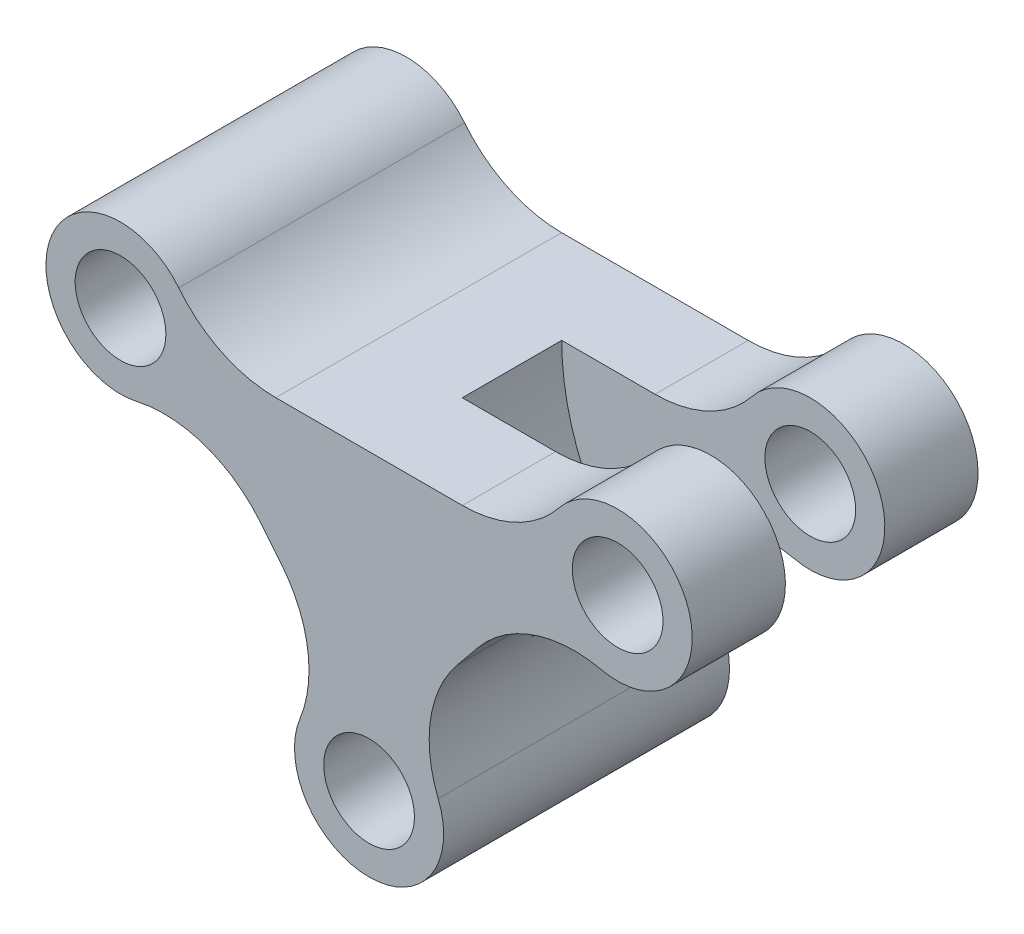
from build123d import *

# Parameters (mm, degrees)
ESQUISSE2_R             = 3
ESQUISSE2_R_2           = 1.825
BOSS_EXTRU_1_DEPTH      = 11.5
ESQUISSE3_R             = 10
ENL_V_MAT_EXTRU_1_DEPTH = 4
CONG_1_R                = 5
FILLET1_R               = 5


with BuildPart() as part:
    # Esquisse2 → Boss.-Extru.1 (new body)
    # profile 1 of 4: a face of its own
    with BuildSketch(Plane.XY):
        with Locations((-10, 5)):
            Circle(ESQUISSE2_R)
        with Locations((-10, 5)):
            Circle(ESQUISSE2_R_2, mode=Mode.SUBTRACT)
    # profile 2 of 4: a face of its own
    with BuildSketch(Plane.XY):
        with Locations((10, 5)):
            Circle(ESQUISSE2_R)
        with Locations((10, 5)):
            Circle(ESQUISSE2_R_2, mode=Mode.SUBTRACT)
    # profile 3 of 4: a face of its own
    with BuildSketch(Plane.XY):
        with Locations((0, -6.825)):
            Circle(ESQUISSE2_R)
        with Locations((0, -6.825)):
            Circle(ESQUISSE2_R_2, mode=Mode.SUBTRACT)
    # profile 4 of 4: a face of its own
    with BuildSketch(Plane.XY):
        Polygon((-8.175, 5), (8.175, 5), (0, -5), align=None)
    extrude(amount=BOSS_EXTRU_1_DEPTH)

    # Esquisse3 → Enlèv. mat.-Extru.1 (cut)
    with BuildSketch(Plane.XY.offset(3.75)):
        with Locations((10, 5)):
            Circle(ESQUISSE3_R)
    extrude(amount=ENL_V_MAT_EXTRU_1_DEPTH, mode=Mode.SUBTRACT)

    # Congé1
    # the kernel refuses this fillet: 5 mm, written as the material it adds along each edge
    with BuildSketch(Plane(origin=(-7, 5, 0), x_dir=(-0.3311912213512006, 0.9435636570469954, 0), z_dir=(0, 0, 1))) as cong_1_piece_1:
        with BuildLine():
            CenterArc((3.643103435, -4.717818285), CONG_1_R, 109.341093727, 51.317812547)
            Line((-1.07471485, -3.061862178), (0, 0))
            ThreePointArc((0, 0), (0.993573664, -0.169309029), (1.987147328, 0))
        make_face()
    extrude(amount=11.5)
    with BuildSketch(Plane(origin=(-7.231093941, 3.845374851, 11.5), x_dir=(-0.7661000074497634, -0.6427213848826507, 0), z_dir=(0, 0, -1))) as cong_1_piece_2:
        with BuildLine():
            CenterArc((5.056907819, -4.440322454), CONG_1_R, 117.368969646, 63.360078756)
            Line((0.057312583, -4.503942212), (0, 0))
            ThreePointArc((0, 0), (1.379156678, -0.335806528), (2.758313356, 0))
        make_face()
    extrude(amount=11.5)
    with BuildSketch(Plane(origin=(-0.858096974, -3.950340093, 11.5), x_dir=(-0.6329215353519139, 0.7742159453846039, 0), z_dir=(0, 0, -1))) as cong_1_piece_3:
        with BuildLine():
            CenterArc((4.246739065, -5), CONG_1_R, 90, 61.27443838)
            ThreePointArc((-0.137920096, -2.596926126), (0.227062491, -1.314184518), (0, 0))
            Line((0, 0), (4.246739065, 0))
        make_face()
    extrude(amount=11.5)
    with BuildSketch(Plane(origin=(7.231093941, 3.845374851, 11.5), x_dir=(-0.6329215353519138, -0.774215945384604, 0), z_dir=(0, 0, -1))) as cong_1_piece_4:
        with BuildLine():
            CenterArc((4.504306848, -5), CONG_1_R, 90, 63.360078756)
            ThreePointArc((0.035096646, -2.758090063), (0.353327666, -1.374772245), (0, 0))
            Line((0, 0), (4.504306848, 0))
        make_face()
    extrude(amount=3.75)
    with BuildSketch(Plane(origin=(7, 5, 11.5), x_dir=(-1, 0, 0), z_dir=(0, 0, -1))) as cong_1_piece_5:
        with BuildLine():
            CenterArc((3.244997998, 5), CONG_1_R, 218.682187453, 51.317812547)
            ThreePointArc((-0.658125751, 1.875), (-0.169309029, 0.993573664), (0, 0))
            Line((0, 0), (3.244997998, 0))
        make_face()
    extrude(amount=3.75)
    with BuildSketch(Plane(origin=(0.858096974, -3.950340093, 11.5), x_dir=(0.7395598752725667, -0.6730907746261462, 0), z_dir=(0, 0, -1))) as cong_1_piece_6_section:
        with BuildLine():
            CenterArc((4.767740899, -4.505933799), CONG_1_R, 115.685497342, 61.27443838)
            Line((-0.225222573, -4.240762606), (0, 0))
            ThreePointArc((0, 0), (1.300292973, -0.29643972), (2.600585945, 0))
        make_face()
    cong_1_piece_6 = extrude(amount=11.5, mode=Mode.PRIVATE)
    cong_1_piece_6 = cong_1_piece_6 - Plane(origin=(10, 5, 9.625), x_dir=(1, 0, 0), z_dir=(0, 0, -1)) * Cylinder(10, 40, mode=Mode.PRIVATE)
    add(cong_1_piece_6)
    with BuildSketch(Plane(origin=(0.858096974, -3.950340093, 11.5), x_dir=(0.7395598752725667, -0.6730907746261462, 0), z_dir=(0, 0, -1))) as cong_1_piece_7_section:
        with BuildLine():
            CenterArc((4.767740899, -4.505933799), CONG_1_R, 115.685497342, 61.27443838)
            Line((-0.225222573, -4.240762606), (0, 0))
            ThreePointArc((0, 0), (1.300292973, -0.29643972), (2.600585945, 0))
        make_face()
    cong_1_piece_7 = extrude(amount=22.116847663, mode=Mode.PRIVATE)
    cong_1_piece_7 = split(cong_1_piece_7, bisect_by=Plane(origin=(2.909028405, -1.544063306, 7.75), z_dir=(0, 0, 1)), keep=Keep.TOP, mode=Mode.PRIVATE)
    add(cong_1_piece_7)
    with BuildSketch(Plane(origin=(0.858096974, -3.950340093, 22.116847663), x_dir=(0.7395598752725666, -0.6730907746261463, 0), z_dir=(0, 0, -1))) as cong_1_piece_8_section:
        with BuildLine():
            CenterArc((4.767740899, -4.505933799), CONG_1_R, 115.685497342, 61.27443838)
            Line((-0.225222573, -4.240762606), (0, 0))
            ThreePointArc((0, 0), (1.300292973, -0.29643972), (2.600585945, 0))
        make_face()
    cong_1_piece_8 = extrude(amount=22.116847663, mode=Mode.PRIVATE)
    cong_1_piece_8 = split(cong_1_piece_8, bisect_by=Plane(origin=(2.909028405, -1.544063306, 3.75), z_dir=(0, 0, -1)), keep=Keep.TOP, mode=Mode.PRIVATE)
    add(cong_1_piece_8)

    # Fillet1
    fillet1_edges = [part.edges().sort_by_distance(p)[0] for p in [
        (7.231093941, 3.845374851, 1.875),
        (7, 5, 1.875),
    ]]
    fillet(fillet1_edges, radius=FILLET1_R)


solid = part.part
